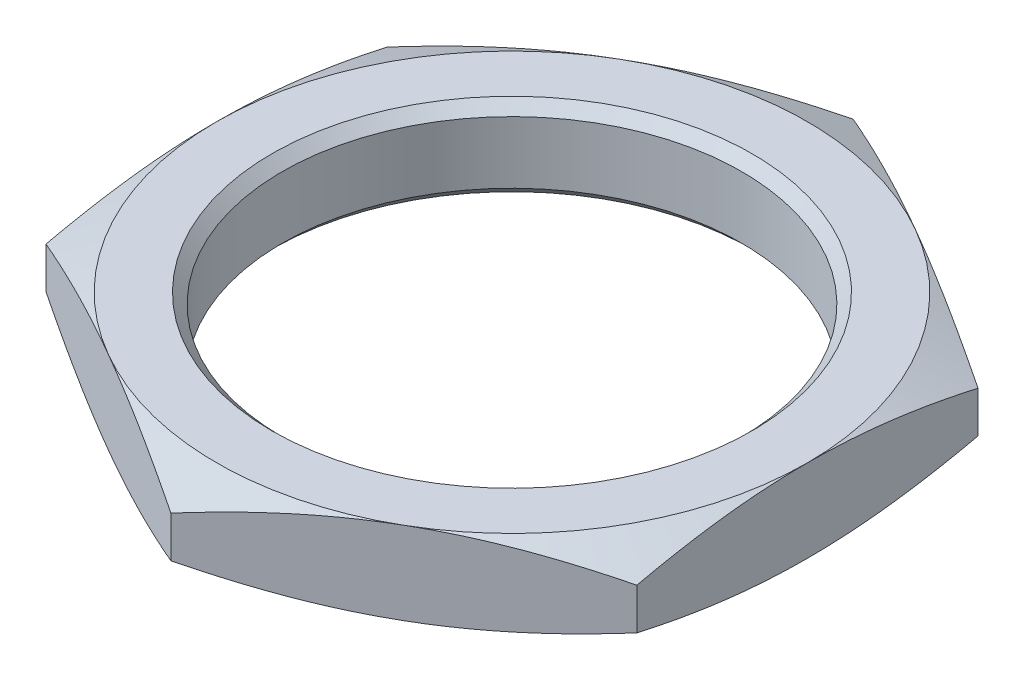
from build123d import *

# Parameters (mm, degrees)
SKETCH1_R           = 5.55625
BOSS_EXTRUDE1_DEPTH = 1
CHAMFER1_SIZE       = 0.25


with BuildPart() as part:
    # Sketch1 → Boss-Extrude1 (new, symmetric)
    with BuildSketch(Plane(origin=(0, 0, 0), x_dir=(1, 0, 0), z_dir=(0, 1, 0))):
        Polygon((0, 8.25), (-7.144709581, 4.125), (-7.144709581, -4.125), (0, -8.25), (7.144709581, -4.125), (7.144709581, 4.125), align=None)
        Circle(SKETCH1_R, mode=Mode.SUBTRACT)
    extrude(amount=BOSS_EXTRUDE1_DEPTH, both=True)

    # Sketch4 → Cut-Revolve1 (revolve, cut)
    with BuildSketch(Plane.XY):
        Polygon((-7.144709581, 1), (-8.25, 0.5), (-8.644709581, 0.5), (-8.644709581, 2), (-7.144709581, 2), align=None)
        Polygon((-7.144709581, -2), (-7.144709581, -1), (-8.25, -0.5), (-8.644709581, -0.5), (-8.644709581, -2), align=None)
    revolve(axis=Axis((0, 1, 0), (0, -1, 0)), mode=Mode.SUBTRACT)

    # Chamfer1
    chamfer1_edges = [part.edges().sort_by_distance(p)[0] for p in [
        (-5.55625, -1, 0),
        (-5.55625, 1, 0),
    ]]
    chamfer(chamfer1_edges, length=CHAMFER1_SIZE)


solid = part.part
